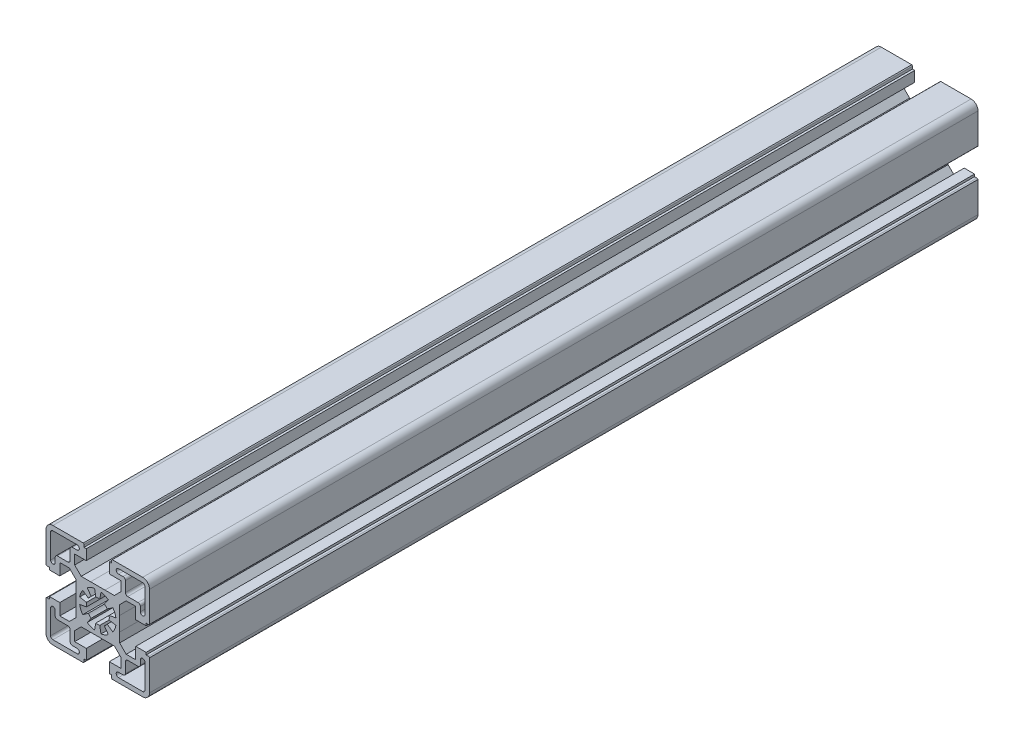
from build123d import *

# Parameters (mm, degrees)
BOSS_EXTRUDE1_DEPTH = 360


with BuildPart() as part:
    # Sketch1 → Boss-Extrude1 (new body)
    with BuildSketch(Plane.XY):
        with BuildLine():
            Line((-9.499953806, 7.206970084), (-9.499953806, 3.122740916))
            Line((-9.499953806, 3.122740916), (-9.499875319, -3.122784036))
            Line((-9.499875319, -3.122784036), (-9.499875319, -7.207137036))
            Line((-9.499875319, -7.207137036), (-12.342824291, -10.050086009))
            Line((-12.342824291, -10.050086009), (-16.499959846, -10.050086009))
            Line((-16.499959846, -10.050086009), (-16.499959846, -5))
            Line((-16.499959846, -5), (-20.999918083, -5))
            Line((-20.999918083, -5), (-20.999918083, -6))
            Line((-20.999918083, -6), (-21.999918456, -6))
            ThreePointArc((-21.999918456, -6), (-22.298205758, -6.069541349), (-22.5, -6.299954884))
            Line((-22.5, -6.299954884), (-22.5, -19.499922911))
            ThreePointArc((-22.5, -19.499922911), (-21.621321, -21.62124167), (-19.500002241, -22.49992067))
            Line((-19.500002241, -22.49992067), (-6.299929564, -22.49992067))
            ThreePointArc((-6.299929564, -22.49992067), (-6.069539801, -22.298164639), (-6, -21.99992119))
            Line((-6, -21.99992119), (-6, -20.999920806))
            Line((-6, -20.999920806), (-4.999940084, -20.999920806))
            Line((-4.999940084, -20.999920806), (-4.999940084, -16.500012806))
            Line((-4.999940084, -16.500012806), (-10.049940084, -16.500012806))
            Line((-10.049940084, -16.500012806), (-10.049940084, -12.342923806))
            Line((-10.049940084, -12.342923806), (-7.206970084, -9.499953806))
            Line((-7.206970084, -9.499953806), (-3.122740916, -9.499953806))
            Line((-3.122740916, -9.499953806), (3.122784036, -9.499875319))
            Line((3.122784036, -9.499875319), (7.207137036, -9.499875319))
            Line((7.207137036, -9.499875319), (10.050086009, -12.342824291))
            Line((10.050086009, -12.342824291), (10.050086009, -16.499959846))
            Line((10.050086009, -16.499959846), (5, -16.499959846))
            Line((5, -16.499959846), (5, -20.999918083))
            Line((5, -20.999918083), (6, -20.999918083))
            Line((6, -20.999918083), (6, -21.999918456))
            ThreePointArc((6, -21.999918456), (6.069541349, -22.298205758), (6.299954884, -22.5))
            Line((6.299954884, -22.5), (19.499922911, -22.5))
            ThreePointArc((19.499922911, -22.5), (21.62124167, -21.621321), (22.49992067, -19.500002241))
            Line((22.49992067, -19.500002241), (22.49992067, -6.299929564))
            ThreePointArc((22.49992067, -6.299929564), (22.298164639, -6.069539801), (21.99992119, -6))
            Line((21.99992119, -6), (20.999920806, -6))
            Line((20.999920806, -6), (20.999920806, -4.999940084))
            Line((20.999920806, -4.999940084), (16.500012806, -4.999940084))
            Line((16.500012806, -4.999940084), (16.500012806, -10.049940084))
            Line((16.500012806, -10.049940084), (12.342923806, -10.049940084))
            Line((12.342923806, -10.049940084), (9.499953806, -7.206970084))
            Line((9.499953806, -7.206970084), (9.499953806, -3.122740916))
            Line((9.499953806, -3.122740916), (9.499875319, 3.122784036))
            Line((9.499875319, 3.122784036), (9.499875319, 7.207137036))
            Line((9.499875319, 7.207137036), (12.342824291, 10.050086009))
            Line((12.342824291, 10.050086009), (16.499959846, 10.050086009))
            Line((16.499959846, 10.050086009), (16.499959846, 5))
            Line((16.499959846, 5), (20.999918083, 5))
            Line((20.999918083, 5), (20.999918083, 6))
            Line((20.999918083, 6), (21.999918456, 6))
            ThreePointArc((21.999918456, 6), (22.298205758, 6.069541349), (22.5, 6.299954884))
            Line((22.5, 6.299954884), (22.5, 19.499922911))
            ThreePointArc((22.5, 19.499922911), (21.621321, 21.62124167), (19.500002241, 22.49992067))
            Line((19.500002241, 22.49992067), (6.299929564, 22.49992067))
            ThreePointArc((6.299929564, 22.49992067), (6.069539801, 22.298164639), (6, 21.99992119))
            Line((6, 21.99992119), (6, 20.999920806))
            Line((6, 20.999920806), (4.999940084, 20.999920806))
            Line((4.999940084, 20.999920806), (4.999940084, 16.500012806))
            Line((4.999940084, 16.500012806), (10.049940084, 16.500012806))
            Line((10.049940084, 16.500012806), (10.049940084, 12.342923806))
            Line((10.049940084, 12.342923806), (7.206970084, 9.499953806))
            Line((7.206970084, 9.499953806), (3.122740916, 9.499953806))
            Line((3.122740916, 9.499953806), (-3.122784036, 9.499875319))
            Line((-3.122784036, 9.499875319), (-7.207137036, 9.499875319))
            Line((-7.207137036, 9.499875319), (-10.050086009, 12.342824291))
            Line((-10.050086009, 12.342824291), (-10.050086009, 16.499959846))
            Line((-10.050086009, 16.499959846), (-5, 16.499959846))
            Line((-5, 16.499959846), (-5, 20.999918083))
            Line((-5, 20.999918083), (-6, 20.999918083))
            Line((-6, 20.999918083), (-6, 21.999918456))
            ThreePointArc((-6, 21.999918456), (-6.069541349, 22.298205758), (-6.299954884, 22.5))
            Line((-6.299954884, 22.5), (-19.499922911, 22.5))
            ThreePointArc((-19.499922911, 22.5), (-21.62124167, 21.621321), (-22.49992067, 19.500002241))
            Line((-22.49992067, 19.500002241), (-22.49992067, 6.299929564))
            ThreePointArc((-22.49992067, 6.299929564), (-22.298164639, 6.069539801), (-21.99992119, 6))
            Line((-21.99992119, 6), (-20.999920806, 6))
            Line((-20.999920806, 6), (-20.999920806, 4.999940084))
            Line((-20.999920806, 4.999940084), (-16.500012806, 4.999940084))
            Line((-16.500012806, 4.999940084), (-16.500012806, 10.049940084))
            Line((-16.500012806, 10.049940084), (-12.342923806, 10.049940084))
            Line((-12.342923806, 10.049940084), (-9.499953806, 7.206970084))
        make_face()
        with BuildLine():
            Line((-12.000017917, -13.000117238), (-12.000017917, -17.500118733))
            ThreePointArc((-12.000017917, -17.500118733), (-11.707124917, -18.207224985), (-11.000018664, -18.500117985))
            Line((-11.000018664, -18.500117985), (-8.999920083, -18.500117985))
            ThreePointArc((-8.999920083, -18.500117985), (-7.999920083, -19.500117985), (-8.999920083, -20.500117985))
            Line((-8.999920083, -20.500117985), (-19.500018664, -20.500117985))
            ThreePointArc((-19.500018664, -20.500117985), (-20.207124917, -20.207224985), (-20.500017917, -19.500118733))
            Line((-20.500017917, -19.500118733), (-20.500017917, -9.000117986))
            ThreePointArc((-20.500017917, -9.000117986), (-19.499969, -8.000069069), (-18.499920083, -9.000117986))
            Line((-18.499920083, -9.000117986), (-18.499920083, -11.000118733))
            ThreePointArc((-18.499920083, -11.000118733), (-18.207027083, -11.707224986), (-17.49992083, -12.000117986))
            Line((-17.49992083, -12.000117986), (-13.00001717, -12.000117986))
            ThreePointArc((-13.00001717, -12.000117986), (-12.292910917, -12.293010986), (-12.000017917, -13.000117238))
        make_face(mode=Mode.SUBTRACT)
        with BuildLine():
            Line((13.000117238, -12.000017917), (17.500118733, -12.000017917))
            ThreePointArc((17.500118733, -12.000017917), (18.207224985, -11.707124917), (18.500117985, -11.000018664))
            Line((18.500117985, -11.000018664), (18.500117985, -8.999920083))
            ThreePointArc((18.500117985, -8.999920083), (19.500117985, -7.999920083), (20.500117985, -8.999920083))
            Line((20.500117985, -8.999920083), (20.500117985, -19.500018664))
            ThreePointArc((20.500117985, -19.500018664), (20.207224985, -20.207124917), (19.500118733, -20.500017917))
            Line((19.500118733, -20.500017917), (9.000117986, -20.500017917))
            ThreePointArc((9.000117986, -20.500017917), (8.000069069, -19.499969), (9.000117986, -18.499920083))
            Line((9.000117986, -18.499920083), (11.000118733, -18.499920083))
            ThreePointArc((11.000118733, -18.499920083), (11.707224986, -18.207027083), (12.000117986, -17.49992083))
            Line((12.000117986, -17.49992083), (12.000117986, -13.00001717))
            ThreePointArc((12.000117986, -13.00001717), (12.293010986, -12.292910917), (13.000117238, -12.000017917))
        make_face(mode=Mode.SUBTRACT)
        with BuildLine():
            Line((-13.000117238, 12.000017917), (-17.500118733, 12.000017917))
            ThreePointArc((-17.500118733, 12.000017917), (-18.207224985, 11.707124917), (-18.500117985, 11.000018664))
            Line((-18.500117985, 11.000018664), (-18.500117985, 8.999920083))
            ThreePointArc((-18.500117985, 8.999920083), (-19.500117986, 7.999920083), (-20.500117986, 8.999920083))
            Line((-20.500117986, 8.999920083), (-20.500117986, 19.500018664))
            ThreePointArc((-20.500117986, 19.500018664), (-20.207224985, 20.207124917), (-19.500118733, 20.500017917))
            Line((-19.500118733, 20.500017917), (-9.000117986, 20.500017917))
            ThreePointArc((-9.000117986, 20.500017917), (-8.000069069, 19.499969), (-9.000117986, 18.499920083))
            Line((-9.000117986, 18.499920083), (-11.000118733, 18.499920083))
            ThreePointArc((-11.000118733, 18.499920083), (-11.707224986, 18.207027083), (-12.000117986, 17.49992083))
            Line((-12.000117986, 17.49992083), (-12.000117986, 13.00001717))
            ThreePointArc((-12.000117986, 13.00001717), (-12.293010986, 12.292910917), (-13.000117238, 12.000017917))
        make_face(mode=Mode.SUBTRACT)
        with BuildLine():
            Line((-1.389161146, 7.878452813), (-0.868223842, 4.924022376))
            ThreePointArc((-0.868223842, 4.924022376), (6.442e-06, 4.9999809), (0.868236529, 4.924020139))
            Line((0.868236529, 4.924020139), (1.389181447, 7.878449234))
            ThreePointArc((1.389181447, 7.878449234), (3.061463561, 7.391023494), (4.588607361, 6.553203027))
            Line((4.588607361, 6.553203027), (2.867873408, 4.095743048))
            ThreePointArc((2.867873408, 4.095743048), (3.535515019, 3.535525782), (4.095734317, 2.867885877))
            Line((4.095734317, 2.867885877), (6.553189057, 4.588627311))
            ThreePointArc((6.553189057, 4.588627311), (7.391022778, 3.061465289), (7.878452813, 1.389161146))
            Line((7.878452813, 1.389161146), (4.924022376, 0.868223842))
            ThreePointArc((4.924022376, 0.868223842), (4.9999809, -6.442e-06), (4.924020139, -0.868236529))
            Line((4.924020139, -0.868236529), (7.878449234, -1.389181447))
            ThreePointArc((7.878449234, -1.389181447), (7.391023494, -3.061463561), (6.553203027, -4.588607361))
            Line((6.553203027, -4.588607361), (4.095743048, -2.867873408))
            ThreePointArc((4.095743048, -2.867873408), (3.535525782, -3.535515019), (2.867885877, -4.095734317))
            Line((2.867885877, -4.095734317), (4.588627311, -6.553189057))
            ThreePointArc((4.588627311, -6.553189057), (3.061465289, -7.391022778), (1.389161146, -7.878452813))
            Line((1.389161146, -7.878452813), (0.868223842, -4.924022376))
            ThreePointArc((0.868223842, -4.924022376), (-6.442e-06, -4.9999809), (-0.868236529, -4.924020139))
            Line((-0.868236529, -4.924020139), (-1.389181447, -7.878449234))
            ThreePointArc((-1.389181447, -7.878449234), (-3.061463561, -7.391023494), (-4.588607361, -6.553203027))
            Line((-4.588607361, -6.553203027), (-2.867873408, -4.095743048))
            ThreePointArc((-2.867873408, -4.095743048), (-3.535515019, -3.535525782), (-4.095734317, -2.867885877))
            Line((-4.095734317, -2.867885877), (-6.553189057, -4.588627311))
            ThreePointArc((-6.553189057, -4.588627311), (-7.391022778, -3.061465289), (-7.878452813, -1.389161146))
            Line((-7.878452813, -1.389161146), (-4.924022376, -0.868223842))
            ThreePointArc((-4.924022376, -0.868223842), (-4.9999809, 6.442e-06), (-4.924020139, 0.868236529))
            Line((-4.924020139, 0.868236529), (-7.878449234, 1.389181447))
            ThreePointArc((-7.878449234, 1.389181447), (-7.391023494, 3.061463561), (-6.553203027, 4.588607361))
            Line((-6.553203027, 4.588607361), (-4.095743048, 2.867873408))
            ThreePointArc((-4.095743048, 2.867873408), (-3.535525782, 3.535515019), (-2.867885877, 4.095734317))
            Line((-2.867885877, 4.095734317), (-4.588627311, 6.553189057))
            ThreePointArc((-4.588627311, 6.553189057), (-3.061465289, 7.391022778), (-1.389161146, 7.878452813))
        make_face(mode=Mode.SUBTRACT)
        with BuildLine():
            Line((12.000017917, 13.000117238), (12.000017917, 17.500118733))
            ThreePointArc((12.000017917, 17.500118733), (11.707124917, 18.207224985), (11.000018664, 18.500117985))
            Line((11.000018664, 18.500117985), (8.999920083, 18.500117985))
            ThreePointArc((8.999920083, 18.500117985), (7.999920083, 19.500117985), (8.999920083, 20.500117985))
            Line((8.999920083, 20.500117985), (19.500018664, 20.500117985))
            ThreePointArc((19.500018664, 20.500117985), (20.207124917, 20.207224985), (20.500017917, 19.500118733))
            Line((20.500017917, 19.500118733), (20.500017917, 9.000117986))
            ThreePointArc((20.500017917, 9.000117986), (19.499969, 8.000069069), (18.499920083, 9.000117986))
            Line((18.499920083, 9.000117986), (18.499920083, 11.000118733))
            ThreePointArc((18.499920083, 11.000118733), (18.207027083, 11.707224986), (17.49992083, 12.000117986))
            Line((17.49992083, 12.000117986), (13.00001717, 12.000117986))
            ThreePointArc((13.00001717, 12.000117986), (12.292910917, 12.293010986), (12.000017917, 13.000117238))
        make_face(mode=Mode.SUBTRACT)
    extrude(amount=BOSS_EXTRUDE1_DEPTH)


solid = part.part
